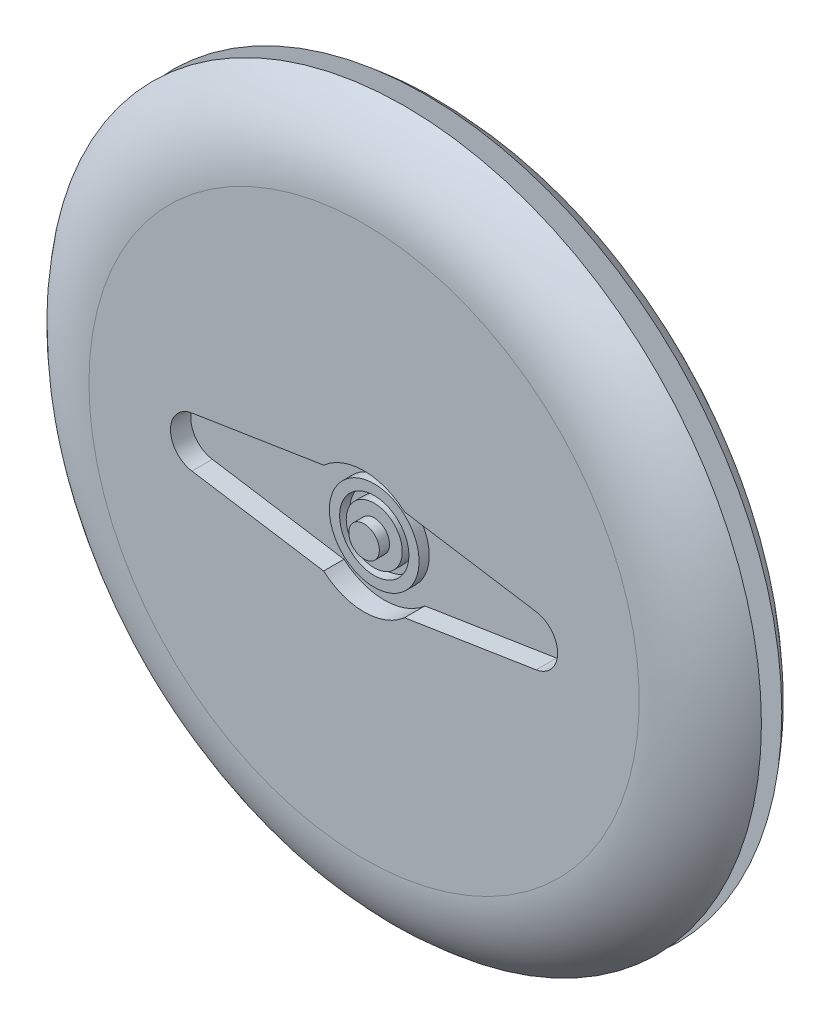
from build123d import *

# Parameters (mm, degrees)
SKETCH_1_R               = 1.5
EXTRUDE_1_DEPTH          = 2.3
SKETCH_2_R               = 4.4
EXTRUDE_2_DEPTH          = 3.2
SKETCH_3_R               = 4.4
SKETCH_3_R_2             = 3.4
SKETCH_3_R_3             = 2.75
SKETCH_3_R_4             = 1.5
CUT_EXTRUDE_1_DEPTH      = 1
BOSS_EXTRUDE1_DEPTH      = 2
BOSS_EXTRUDE1_DEPTH_BACK = 2
SKETCH1_R                = 35
INTERSECT2_OUTLINE_R     = 4.4
INTERSECT2_OUTLINE_R_2   = 3.4
INTERSECT2_OUTLINE_R_3   = 2.75
INTERSECT2_DEPTH         = 5.5
INTERSECT2_START         = 1
INTERSECT2_2_OUTLINE_R   = 4.4
INTERSECT2_2_OUTLINE_R_2 = 3.4
INTERSECT2_2_OUTLINE_R_3 = 2.75
INTERSECT2_2_OUTLINE_R_4 = 1.5
INTERSECT2_2_DEPTH       = 4.5
FILLET1_R                = 10
SKETCH2_R                = 25
BOSS_EXTRUDE2_DEPTH      = 2
SKETCH3_R                = 27
BOSS_EXTRUDE3_DEPTH      = 2


# Read off the part's stored shape, not the designer's step: Intersect2
with BuildPart() as part:
    # Эскиз1 → Бобышка-Вытянуть1 (new body)
    with BuildSketch(Plane.XY):
        with BuildLine():
            Line((-3.968626967, 4.5), (-16.888114198, 2.469689731))
            ThreePointArc((-16.888114198, 2.469689731), (-19, 0), (-16.888114198, -2.469689731))
            Line((-16.888114198, -2.469689731), (-3.968626967, -4.5))
            ThreePointArc((-3.968626967, -4.5), (0, -6), (3.968626967, -4.5))
            Line((3.968626967, -4.5), (16.888114198, -2.469689731))
            ThreePointArc((16.888114198, -2.469689731), (19, 0), (16.888114198, 2.469689731))
            Line((16.888114198, 2.469689731), (3.968626967, 4.5))
            ThreePointArc((3.968626967, 4.5), (0, 6), (-3.968626967, 4.5))
        make_face()
        Circle(SKETCH_1_R, mode=Mode.SUBTRACT)
    extrude(amount=EXTRUDE_1_DEPTH)

    # Эскиз2 → Бобышка-Вытянуть2 (add)
    with BuildSketch(Plane.XY.offset(2.3)):
        with Locations(Location((0, 0, 0), (0, 0, 180))):
            Circle(SKETCH_2_R)
        Polygon((0.333439775, 2.639447604), (0, 3.05), (-0.333439775, 2.639447604), (-0.758504156, 2.954178641), (-0.979368078, 2.473601404), (-1.469348706, 2.672735374), (-1.563759083, 2.15232973), (-2.087868673, 2.223354314), (-2.049893354, 1.695819264), (-2.575200173, 1.634271725), (-2.407225286, 1.132754236), (-2.900722375, 0.942501833), (-2.6133024, 0.498514094), (-3.043981522, 0.191511085), (-2.655176114, -0.167049522), (-2.995976115, -0.571513009), (-2.530215347, -0.822116802), (-2.75972251, -1.298626839), (-2.246271844, -1.42552746), (-2.35006539, -1.944143169), (-1.821186821, -1.939366985), (-1.792745019, -2.467501833), (-1.281669931, -2.33134895), (-1.122779886, -2.835818282), (-0.661621006, -2.576843686), (-0.382266362, -3.025949839), (0, -2.660425857), (0.382266362, -3.025949839), (0.661621006, -2.576843686), (1.122779886, -2.835818282), (1.281669931, -2.33134895), (1.792745019, -2.467501833), (1.821186821, -1.939366985), (2.35006539, -1.944143169), (2.246271844, -1.42552746), (2.75972251, -1.298626839), (2.530215347, -0.822116802), (2.995976115, -0.571513009), (2.655176114, -0.167049522), (3.043981522, 0.191511085), (2.6133024, 0.498514094), (2.900722375, 0.942501833), (2.407225286, 1.132754236), (2.575200173, 1.634271725), (2.049893354, 1.695819264), (2.087868673, 2.223354314), (1.563759083, 2.15232973), (1.469348706, 2.672735374), (0.979368078, 2.473601404), (0.758504156, 2.954178641), align=None, mode=Mode.SUBTRACT)
    extrude(amount=EXTRUDE_2_DEPTH)

    # Эскиз3 → Вырез-Вытянуть1 (cut)
    # profile 1 of 2: a face of its own
    with BuildSketch(Plane(origin=(0, 0, 0), x_dir=(-1, 0, 0), z_dir=(0, 0, -1))):
        Circle(SKETCH_3_R)
        Circle(SKETCH_3_R_2, mode=Mode.SUBTRACT)
    # profile 2 of 2: a face of its own
    with BuildSketch(Plane(origin=(0, 0, 0), x_dir=(-1, 0, 0), z_dir=(0, 0, -1))):
        Circle(SKETCH_3_R_3)
        Circle(SKETCH_3_R_4, mode=Mode.SUBTRACT)
    extrude(amount=-CUT_EXTRUDE_1_DEPTH, mode=Mode.SUBTRACT)


with BuildPart() as body_2:
    # Sketch1 → Boss-Extrude1 (new, two sides: drawn at the far end of the back side and taken through both)
    with BuildSketch(Plane(origin=(0, 0, 0), x_dir=(-1, 0, 0), z_dir=(0, 0, -1)).offset(-BOSS_EXTRUDE1_DEPTH_BACK)):
        Circle(SKETCH1_R)
    extrude(amount=BOSS_EXTRUDE1_DEPTH + BOSS_EXTRUDE1_DEPTH_BACK)


with BuildPart() as intersect2_tool:
    # Intersect2 outline → Intersect2 (new body)
    # profile 1 of 2: a face of its own
    with BuildSketch(Plane.XY):
        with BuildLine():
            ThreePointArc((3.968626967, 4.5), (0, 6), (-3.968626967, 4.5))
            Line((-3.968626967, 4.5), (-16.888114198, 2.469689731))
            ThreePointArc((-16.888114198, 2.469689731), (-19, 0), (-16.888114198, -2.469689731))
            Line((-16.888114198, -2.469689731), (-3.968626967, -4.5))
            ThreePointArc((-3.968626967, -4.5), (0, -6), (3.968626967, -4.5))
            Line((3.968626967, -4.5), (16.888114198, -2.469689731))
            ThreePointArc((16.888114198, -2.469689731), (19, 0), (16.888114198, 2.469689731))
            Line((16.888114198, 2.469689731), (3.968626967, 4.5))
        make_face()
        Circle(INTERSECT2_OUTLINE_R, mode=Mode.SUBTRACT)
    # profile 2 of 2: a face of its own
    with BuildSketch(Plane.XY):
        Circle(INTERSECT2_OUTLINE_R_2)
        Circle(INTERSECT2_OUTLINE_R_3, mode=Mode.SUBTRACT)
    extrude(amount=INTERSECT2_DEPTH)


with BuildPart() as part_1:
    add(part.part)

    # Intersect2: cut by intersect2_tool
    add(intersect2_tool.part, mode=Mode.SUBTRACT)


with BuildPart() as body_2_1:
    add(body_2.part)

    # Intersect2: cut by intersect2_tool
    add(intersect2_tool.part, mode=Mode.SUBTRACT)


with BuildPart() as intersect2_2_tool:
    # Intersect2 2 outline → Intersect2 2 (new body)
    # profile 1 of 2: a face of its own
    with BuildSketch(Plane.XY.offset(INTERSECT2_START)):
        Circle(INTERSECT2_2_OUTLINE_R)
        Circle(INTERSECT2_2_OUTLINE_R_2, mode=Mode.SUBTRACT)
    # profile 2 of 2: a face of its own
    with BuildSketch(Plane.XY.offset(INTERSECT2_START)):
        Circle(INTERSECT2_2_OUTLINE_R_3)
        Circle(INTERSECT2_2_OUTLINE_R_4, mode=Mode.SUBTRACT)
    extrude(amount=INTERSECT2_2_DEPTH)


with BuildPart() as part_2:
    add(part_1.part)

    # Intersect2 2: cut by intersect2_2_tool
    add(intersect2_2_tool.part, mode=Mode.SUBTRACT)


with BuildPart() as body_2_2:
    add(body_2_1.part)

    # Intersect2 2: cut by intersect2_2_tool
    add(intersect2_2_tool.part, mode=Mode.SUBTRACT)

    # Fillet1
    # the kernel refuses this fillet: 10 mm, written as the material it takes off along each edge
    with BuildSketch(Plane(origin=(0, 0, 2), x_dir=(-1, 0, 0), z_dir=(0, -1, 0))) as fillet1_piece_1:
        with BuildLine():
            CenterArc((27, 10), FILLET1_R, 270, 53.130102354)
            Line((27, 0), (27, -0.2))
            Line((27, -0.2), (35, -0.2))
            Line((35, -0.2), (35.2, 0))
            ThreePointArc((35.2, 0), (35.2, 2), (35.16, 3.88))
            Line((35.16, 3.88), (35, 4))
        make_face()
    revolve(axis=Axis((0, 0, 2), (0, 0, -1)), mode=Mode.SUBTRACT)


with BuildPart() as body_2_2_1:
    # Mirror9: mirrored copy
    add(body_2_2.part.mirror(Plane.XY.offset(-3)))

    # Sketch3 → Boss-Extrude3 (add)
    with BuildSketch(Plane(origin=(0, 0, -8), x_dir=(-1, 0, 0), z_dir=(0, 0, -1))):
        Circle(SKETCH3_R)
    extrude(amount=-BOSS_EXTRUDE3_DEPTH)


with BuildPart() as body_2_3:
    add(body_2_2.part)

    # Sketch2 → Boss-Extrude2 (add)
    with BuildSketch(Plane(origin=(0, 0, -2), x_dir=(-1, 0, 0), z_dir=(0, 0, -1))):
        Circle(SKETCH2_R)
    extrude(amount=BOSS_EXTRUDE2_DEPTH)


solid = Compound([body_2_2_1.part, body_2_3.part])
